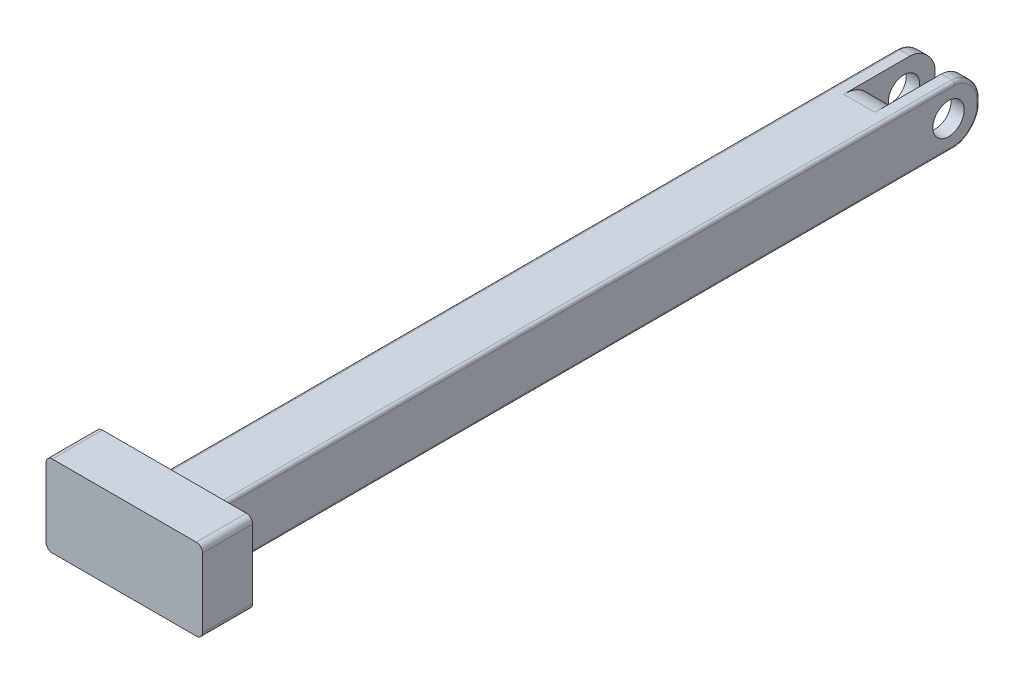
from build123d import *

# Parameters (mm, degrees)
CROQUIS1_W              = 9.25
CROQUIS1_H              = 114
CROQUIS1_H_2            = 10
CROQUIS1_R              = 2.5
SALIENTE_EXTRUIR1_DEPTH = 4.625
SALIENTE_EXTRUIR2_DEPTH = 12.5
CROQUIS1_4_W            = 9.25
CROQUIS1_4_H            = 10
CROQUIS1_4_R            = 2.5
CORTAR_EXTRUIR1_DEPTH   = 2.5
REDONDEO1_SIZE          = 4
REDONDEO2_SIZE          = 4.625
REDONDEO3_R             = 0.5
REDONDEO4_R             = 1


with BuildPart() as part:
    # Croquis1 → Saliente-Extruir1 (new, symmetric)
    # profile 1 of 2: a face of its own
    with BuildSketch(Plane.YZ):
        with Locations((0, 67)):
            Rectangle(CROQUIS1_W, CROQUIS1_H)
    # profile 2 of 2: a face of its own
    with BuildSketch(Plane.YZ):
        with Locations((0, 5)):
            Rectangle(CROQUIS1_W, CROQUIS1_H_2)
        with Locations(Location((0, 5, 0), (0, 0, 270))):
            Circle(CROQUIS1_R, mode=Mode.SUBTRACT)
    extrude(amount=SALIENTE_EXTRUIR1_DEPTH, both=True)

    # Croquis1<3> → Saliente-Extruir2 (add, symmetric)
    with BuildSketch(Plane.YZ):
        Polygon((4.625, 132), (-4.625, 132), (-4.625, 124), (4.625, 124), (8.375, 124), (8.375, 132), align=None)
    extrude(amount=SALIENTE_EXTRUIR2_DEPTH, both=True)

    # Croquis1<4> → Cortar-Extruir1 (cut, symmetric)
    with BuildSketch(Plane.YZ):
        with Locations((0, 5)):
            Rectangle(CROQUIS1_4_W, CROQUIS1_4_H)
        with Locations(Location((0, 5, 0), (0, 0, 270))):
            Circle(CROQUIS1_4_R, mode=Mode.SUBTRACT)
    extrude(amount=CORTAR_EXTRUIR1_DEPTH, both=True, mode=Mode.SUBTRACT)

    # Redondeo1
    # a fillet whose section is not a circle: 4 mm, written as the material it takes off along each edge
    with BuildSketch(Plane(origin=(14.625, -4.625, 0), x_dir=(0, 0, 1), z_dir=(-1, 0, 0)), Plane(origin=(14.625, 4.625, 0), x_dir=(0, -1, 0), z_dir=(-1, 0, 0))) as redondeo1_piece_1:
        with BuildLine():
            Bezier((REDONDEO1_SIZE, 0), (0, 0), (0, REDONDEO1_SIZE), weights=[1, 0.565685425, 1])
            Line((0, REDONDEO1_SIZE), (0, 0))
            Line((0, 0), (REDONDEO1_SIZE, 0))
        make_face()
    extrude(amount=22.125, mode=Mode.SUBTRACT)

    # Redondeo2
    # a fillet whose section is not a circle: 4.625 mm, written as the material it takes off along each edge
    with BuildSketch(Plane(origin=(-2.5, 4.625, 10), x_dir=(0, -1, 0), z_dir=(1, 0, 0)), Plane(origin=(-2.5, -4.625, 10), x_dir=(0, 0, 1), z_dir=(1, 0, 0))) as redondeo2_piece_1:
        with BuildLine():
            Bezier((REDONDEO2_SIZE, 0), (0, 0), (0, -REDONDEO2_SIZE), weights=[1, 0.817592216, 1])
            Line((0, -REDONDEO2_SIZE), (0, 0))
            Line((0, 0), (REDONDEO2_SIZE, 0))
        make_face()
    extrude(amount=5, mode=Mode.SUBTRACT)

    # Redondeo3
    redondeo3_edges = [part.edges().sort_by_distance(p)[0] for p in [
        (4.625, 4.625, 64),
        (4.625, 0, 0),
        (4.625, -4.625, 64),
        (4.625, 3.347604191, 1.277395809),
        (4.625, -3.347604191, 1.277395809),
        (-4.625, 0, 0),
        (-4.625, 3.347604191, 1.277395809),
        (-4.625, -3.347604191, 1.277395809),
        (-4.625, 4.625, 64),
        (-4.625, -4.625, 64),
    ]]
    fillet(redondeo3_edges, radius=REDONDEO3_R)

    # Redondeo4
    redondeo4_edges = [part.edges().sort_by_distance(p)[0] for p in [
        (12.5, 8.375, 128),
        (-12.5, -4.625, 128),
        (12.5, -4.625, 128),
        (-12.5, 8.375, 128),
    ]]
    fillet(redondeo4_edges, radius=REDONDEO4_R)


solid = part.part
